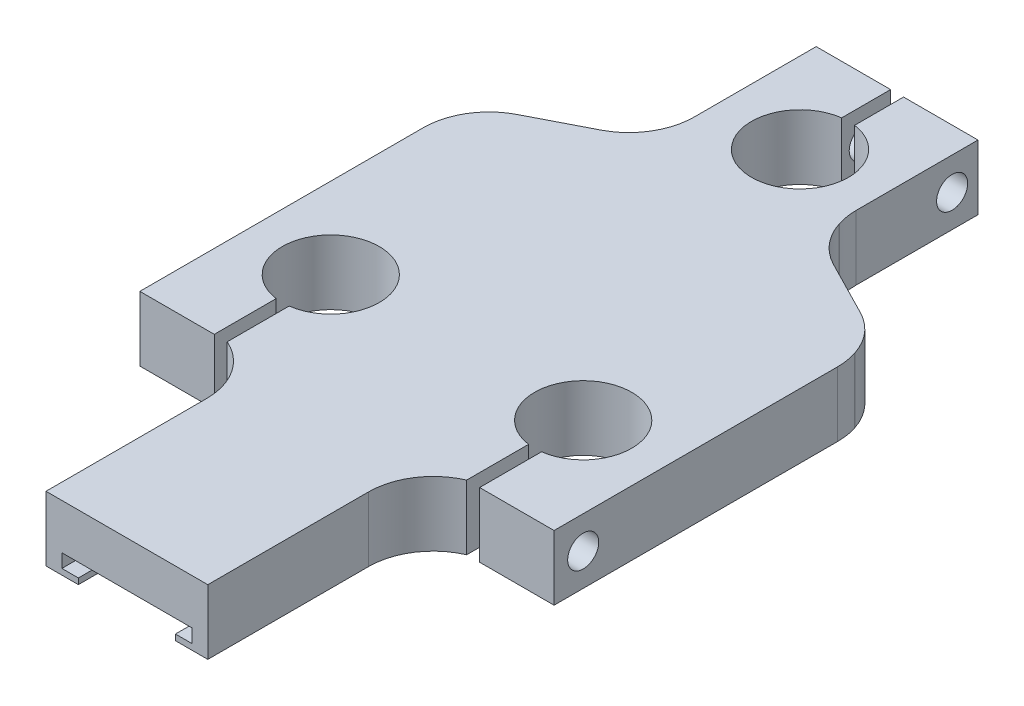
from build123d import *
from OCP.BRepFilletAPI import BRepFilletAPI_MakeChamfer

# Parameters (mm, degrees)
SKETCH1_W               = 24
SKETCH1_H               = 40
BOSS_EXTRUDE1_DEPTH     = 10
SKETCH2_R               = 7.5
BOSS_EXTRUDE2_DEPTH     = 10
SKETCH4_W               = 2
SKETCH4_H               = 20
SKETCH4_H_2             = 16
CUT_EXTRUDE1_DEPTH      = 20
SKETCH5_R               = 2.4
CUT_EXTRUDE2_DEPTH      = 74
CHAMFER3_SIZE           = 2
CHAMFER3_SIZE2          = 4.613601474
BOSS_EXTRUDE3_DEPTH     = 10
CUT_EXTRUDE3_DEPTH      = 10
CUT_EXTRUDE3_DEPTH_BACK = 10
FILLET1_R               = 10
SKETCH8_W               = 5
SKETCH8_H               = 3
CUT_EXTRUDE4_DEPTH      = 5


with BuildPart() as part:
    # Sketch1 → Boss-Extrude1 (new body)
    with BuildSketch(Plane(origin=(0, 0, 0), x_dir=(1, 0, 0), z_dir=(0, 1, 0))):
        Rectangle(SKETCH1_W, SKETCH1_H)
    extrude(amount=BOSS_EXTRUDE1_DEPTH)

    # Sketch2 → Boss-Extrude2 (add)
    with BuildSketch(Plane.XZ):
        Polygon((7, -20), (-7, -20), (-7, 35), (-32, 35), (-32, -15), (-12.5, -25), (-12.5, -50), (12.5, -50), (12.5, -25), (32, -15), (32, 35), (7, 35), align=None)
        with Locations(Location((0, -35, 0), (0, 0, 270))):
            Circle(SKETCH2_R, mode=Mode.SUBTRACT)
        with Locations(Location((-19.5, 18, 0), (0, 0, 270))):
            Circle(SKETCH2_R, mode=Mode.SUBTRACT)
        with Locations(Location((19.5, 18, 0), (0, 0, 270))):
            Circle(SKETCH2_R, mode=Mode.SUBTRACT)
    extrude(amount=-BOSS_EXTRUDE2_DEPTH)

    # Sketch4 → Cut-Extrude1 (cut)
    with BuildSketch(Plane(origin=(0, 10, 0), x_dir=(1, 0, 0), z_dir=(0, 1, 0))):
        with Locations((19.5, -35)):
            Rectangle(SKETCH4_W, SKETCH4_H)
        with Locations((-19.5, -35)):
            Rectangle(SKETCH4_W, SKETCH4_H)
        with Locations((0, 50)):
            Rectangle(SKETCH4_W, SKETCH4_H_2)
    extrude(amount=-CUT_EXTRUDE1_DEPTH, mode=Mode.SUBTRACT)

    # Sketch5 → Cut-Extrude2 (cut)
    with BuildSketch(Plane(origin=(32, 0, 0), x_dir=(0, 0, -1), z_dir=(1, 0, 0))):
        with Locations(Location((-30.5, 5, 0), (0, 0, 180))):
            Circle(SKETCH5_R)
        with Locations(Location((46, 5, 0), (0, 0, 180))):
            Circle(SKETCH5_R)
    extrude(amount=-CUT_EXTRUDE2_DEPTH, mode=Mode.SUBTRACT)

    # Chamfer3: one chamfer whose edges measure the first distance from different faces: ONE call of the kernel's chamfer builder (chamfer() names one face for all edges)
    chamfer3_edges_1 = [part.edges().sort_by_distance(p)[0] for p in [
        (-12.5, 5, -25),
        (-32, 5, -15),
    ]]
    chamfer3_side_1 = [part.faces().sort_by_distance(p)[0] for p in [
        (-22.25, 5, -20),
    ]]
    chamfer3_edges_2 = [part.edges().sort_by_distance(p)[0] for p in [
        (32, 5, -15),
        (12.5, 5, -25),
    ]]
    chamfer3_side_2 = [part.faces().sort_by_distance(p)[0] for p in [
        (22.25, 5, -20),
    ]]
    chamfer3 = BRepFilletAPI_MakeChamfer(part.part.solid().wrapped)
    for e in chamfer3_edges_1:
        chamfer3.Add(CHAMFER3_SIZE, CHAMFER3_SIZE2, e.wrapped, chamfer3_side_1[0].wrapped)  # the first distance lies on this face
    for e in chamfer3_edges_2:
        chamfer3.Add(CHAMFER3_SIZE, CHAMFER3_SIZE2, e.wrapped, chamfer3_side_2[0].wrapped)  # the first distance lies on this face
    add(Compound.cast(chamfer3.Shape()), mode=Mode.REPLACE)

    # Sketch6 → Boss-Extrude3 (add)
    with BuildSketch(Plane.XZ):
        Polygon((-12.5, 22.639119403), (-12.5, 69), (12.5, 69), (12.5, 22.639119403), (7, 20), (-7, 20), align=None)
    extrude(amount=-BOSS_EXTRUDE3_DEPTH)

    # Sketch7 → Cut-Extrude3 (cut, two sides: drawn at the far end of the back side and taken through both)
    with BuildSketch(Plane.XY.offset(69).offset(-CUT_EXTRUDE3_DEPTH_BACK)):
        Polygon((-10.05, 0.9), (-7.5, 0.9), (-7.5, -1.2), (7.5, -1.2), (7.5, 0.9), (10.05, 0.9), (10.05, 3), (-10.05, 3), align=None)
    extrude(amount=CUT_EXTRUDE3_DEPTH + CUT_EXTRUDE3_DEPTH_BACK, mode=Mode.SUBTRACT)

    # Fillet1
    # the kernel refuses this fillet: 10 mm, written as the material it adds along each edge
    with BuildSketch(Plane(origin=(12.5, 0, -29.613601474), x_dir=(0.3065313660894553, 0, 0.9518605578567336), z_dir=(0, 1, 0)), Plane(origin=(-12.5, 0, -29.613601474), x_dir=(0, 0, -1), z_dir=(0, 1, 0))) as fillet1_piece_1:
        with BuildLine():
            CenterArc((FILLET1_R * 0.15704572996, FILLET1_R), FILLET1_R, 252.149681698, 17.850318302)
            Line((-FILLET1_R * 0.149485636129, FILLET1_R * 0.0481394421433), (0, 0))
            Line((0, 0), (FILLET1_R * 0.15704572996, 0))
        make_face()
    extrude(amount=10)
    with BuildSketch(Plane(origin=(14.279634926, 0, -24.087366705), x_dir=(0.8898174628127374, 0, 0.4563166475962744), z_dir=(0, 1, 0)), Plane(origin=(-14.279634926, 0, -24.087366705), x_dir=(0.30653136608945597, 0, -0.9518605578567335), z_dir=(0, 1, 0))) as fillet1_piece_2:
        with BuildLine():
            CenterArc((FILLET1_R * 0.414213562373, FILLET1_R), FILLET1_R, 225, 45)
            Line((-FILLET1_R * 0.292893218813, FILLET1_R * 0.292893218813), (0, 0))
            Line((0, 0), (FILLET1_R * 0.414213562373, 0))
        make_face()
    extrude(amount=10)
    with BuildSketch(Plane(origin=(12.5, 10, 35), x_dir=(0, 0, 1), z_dir=(0, -1, 0))) as fillet1_piece_3:
        with BuildLine():
            CenterArc((9.16515139, -10), FILLET1_R, 90, 66.421821522)
            Line((0, -6), (0, 0))
            Line((0, 0), (9.16515139, 0))
        make_face()
    extrude(amount=10)
    with BuildSketch(Plane(origin=(-12.5, 0, 35), x_dir=(-1, 0, 0), z_dir=(0, 1, 0))) as fillet1_piece_4:
        with BuildLine():
            CenterArc((10, 9.16515139), FILLET1_R, 180, 66.421821522)
            Line((0, 9.16515139), (0, 0))
            Line((0, 0), (6, 0))
        make_face()
    extrude(amount=10)
    # the kernel refuses this fillet: 10 mm, written as the material it takes off along each edge
    with BuildSketch(Plane(origin=(30.220365074, -10.355339059, -15.912633295), x_dir=(-0.8898174628127375, 0, -0.45631664759627466), z_dir=(0, 1, 0))) as fillet1_2_piece_1:
        with BuildLine():
            CenterArc((FILLET1_R * 0.414213562373, FILLET1_R), FILLET1_R, 225, 45)
            Line((-FILLET1_R * 0.292893218813, FILLET1_R * 0.292893218813), (0, 0))
            Line((0, 0), (FILLET1_R * 0.414213562373, 0))
        make_face()
    extrude(amount=30.710678119, mode=Mode.SUBTRACT)
    with BuildSketch(Plane(origin=(32, -3.926143249, -10.386398526), x_dir=(0, 0, 1), z_dir=(0, 1, 0)), Plane(origin=(-32, -3.926143249, -10.386398526), x_dir=(0.3065313660894543, 0, -0.9518605578567341), z_dir=(0, 1, 0))) as fillet1_2_piece_2:
        with BuildLine():
            CenterArc((FILLET1_R * 0.15704572996, -FILLET1_R), FILLET1_R, 90, 17.850318302)
            Line((-FILLET1_R * 0.149485636129, -FILLET1_R * 0.0481394421433), (0, 0))
            Line((0, 0), (FILLET1_R * 0.15704572996, 0))
        make_face()
    extrude(amount=17.852286498, mode=Mode.SUBTRACT)
    with BuildSketch(Plane(origin=(-30.220365074, -10.355339059, -15.912633295), x_dir=(0.889817462812737, 0, -0.45631664759627527), z_dir=(0, 1, 0))) as fillet1_2_piece_3:
        with BuildLine():
            CenterArc((FILLET1_R * 0.414213562373, -FILLET1_R), FILLET1_R, 90, 45)
            Line((-FILLET1_R * 0.292893218813, -FILLET1_R * 0.292893218813), (0, 0))
            Line((0, 0), (FILLET1_R * 0.414213562373, 0))
        make_face()
    extrude(amount=30.710678119, mode=Mode.SUBTRACT)

    # Sketch8 → Cut-Extrude4 (cut)
    with BuildSketch(Plane.XY.offset(59)):
        Rectangle(SKETCH8_W, SKETCH8_H)
    extrude(amount=-CUT_EXTRUDE4_DEPTH, mode=Mode.SUBTRACT)


solid = part.part
